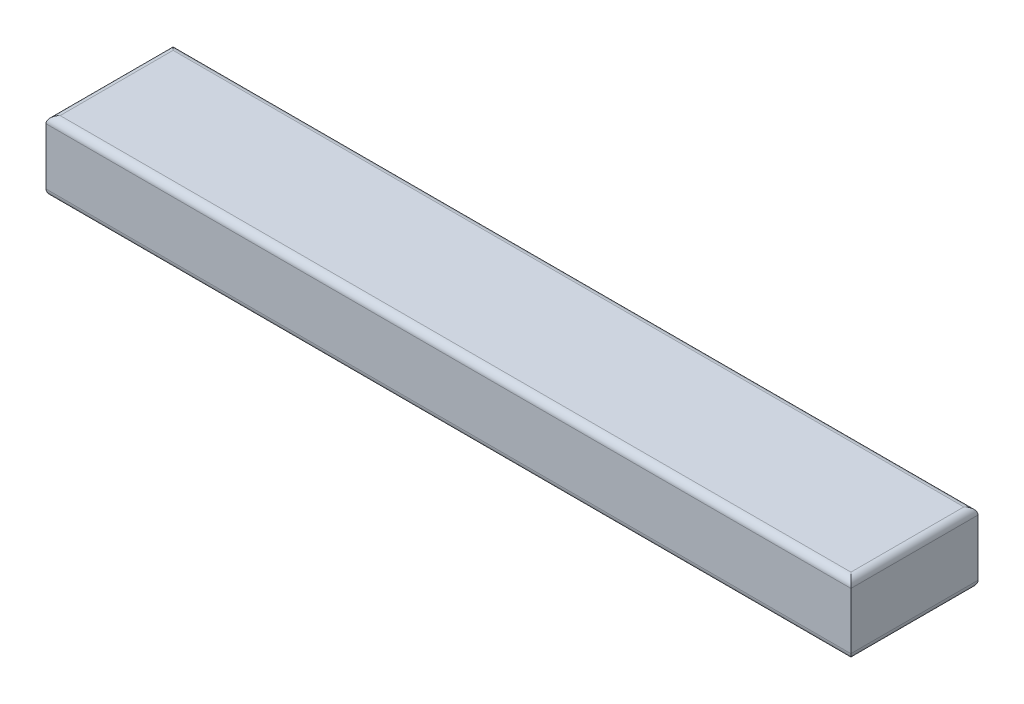
from build123d import *

# Parameters (mm, degrees)
SKETCH2_W           = 28.956
SKETCH2_H           = 4.572
BOSS_EXTRUDE1_DEPTH = 2.54
FILLET1_R           = 0.254


with BuildPart() as part:
    # Sketch2 → Boss-Extrude1 (new body)
    with BuildSketch(Plane(origin=(0, 0, 0), x_dir=(1, 0, 0), z_dir=(0, 1, 0))):
        Rectangle(SKETCH2_W, SKETCH2_H)
    extrude(amount=BOSS_EXTRUDE1_DEPTH)

    # Fillet1
    fillet1_edges = [part.edges().sort_by_distance(p)[0] for p in [
        (0, 0, 2.286),
        (14.478, 0, 0),
        (0, 0, -2.286),
        (-14.478, 0, 0),
        (0, 2.54, -2.286),
        (14.478, 2.54, 0),
        (0, 2.54, 2.286),
        (-14.478, 2.54, 0),
    ]]
    fillet(fillet1_edges, radius=FILLET1_R)


solid = part.part
